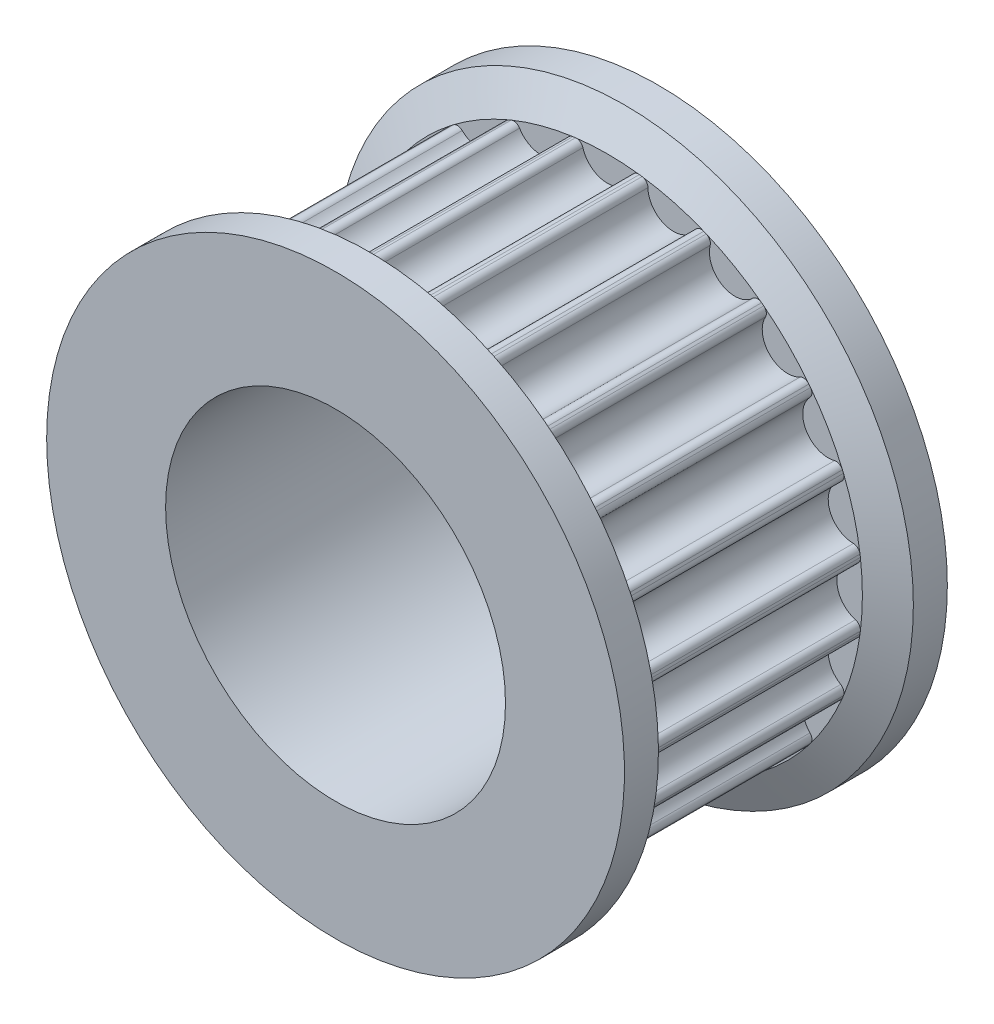
from build123d import *

# Parameters (mm, degrees)
SKETCH1_R           = 7.5
BOSS_EXTRUDE1_DEPTH = 7.5
SKETCH2_R           = 8.5
BOSS_EXTRUDE2_DEPTH = 1
BOSS_EXTRUDE3_START = -1
SKETCH3_R           = 8.5
BOSS_EXTRUDE3_DEPTH = 1
CUT_EXTRUDE3_START  = 0.5
SKETCH6_R           = 0.75
CUT_EXTRUDE3_DEPTH  = 6.5
SKETCH4_R           = 5
CUT_EXTRUDE1_DEPTH  = 8
SKETCH5_R           = 3.75
CUT_EXTRUDE2_DEPTH  = 39.426154601
FILLET2_R           = 0.2


with BuildPart() as part:
    # Sketch1 → Boss-Extrude1 (new body)
    with BuildSketch(Plane.XY.offset(-263.25)):
        with Locations((-3.046542689, 27.266558534)):
            Circle(SKETCH1_R)
    extrude(amount=-BOSS_EXTRUDE1_DEPTH)

    # Sketch2 → Boss-Extrude2 (add)
    with BuildSketch(Plane.XY.offset(-270.75)):
        with Locations((-3.046542689, 27.266558534)):
            Circle(SKETCH2_R)
    extrude(amount=-BOSS_EXTRUDE2_DEPTH)

    # Sketch3 → Boss-Extrude3 (add)
    with BuildSketch(Plane(origin=(0, 0, -263.25), x_dir=(-1, 0, 0), z_dir=(0, 0, -1)).offset(BOSS_EXTRUDE3_START)):
        with Locations(Location((3.046542689, 27.266558534, 0), (0, 0, 180))):
            Circle(SKETCH3_R)
    extrude(amount=BOSS_EXTRUDE3_DEPTH)

    # Sketch6 → Cut-Extrude3 (cut)
    with BuildSketch(Plane.XY.offset(-270.75).offset(CUT_EXTRUDE3_START)):
        with Locations((-3.046542689, 34.766558534)):
            Circle(SKETCH6_R)
        with Locations((-1.10539985, 34.511002232)):
            Circle(SKETCH6_R)
        with Locations((0.703457311, 33.761749063)):
            Circle(SKETCH6_R)
        with Locations((2.25675817, 32.569859393)):
            Circle(SKETCH6_R)
        with Locations((3.44864784, 31.016558534)):
            Circle(SKETCH6_R)
        with Locations((4.197901009, 29.207701373)):
            Circle(SKETCH6_R)
        with Locations((4.453457311, 27.266558534)):
            Circle(SKETCH6_R)
        with Locations((4.197901009, 25.325415696)):
            Circle(SKETCH6_R)
        with Locations((3.44864784, 23.516558534)):
            Circle(SKETCH6_R)
        with Locations((2.25675817, 21.963257675)):
            Circle(SKETCH6_R)
        with Locations((0.703457311, 20.771368006)):
            Circle(SKETCH6_R)
        with Locations((-1.10539985, 20.022114837)):
            Circle(SKETCH6_R)
        with Locations((-3.046542689, 19.766558534)):
            Circle(SKETCH6_R)
        with Locations((-4.987685527, 20.022114837)):
            Circle(SKETCH6_R)
        with Locations((-6.796542689, 20.771368006)):
            Circle(SKETCH6_R)
        with Locations((-8.349843548, 21.963257675)):
            Circle(SKETCH6_R)
        with Locations((-9.541733217, 23.516558534)):
            Circle(SKETCH6_R)
        with Locations((-10.290986386, 25.325415696)):
            Circle(SKETCH6_R)
        with Locations((-10.546542689, 27.266558534)):
            Circle(SKETCH6_R)
        with Locations((-10.290986386, 29.207701373)):
            Circle(SKETCH6_R)
        with Locations((-9.541733217, 31.016558534)):
            Circle(SKETCH6_R)
        with Locations((-8.349843548, 32.569859393)):
            Circle(SKETCH6_R)
        with Locations((-6.796542689, 33.761749063)):
            Circle(SKETCH6_R)
        with Locations((-4.987685527, 34.511002232)):
            Circle(SKETCH6_R)
    extrude(amount=CUT_EXTRUDE3_DEPTH, mode=Mode.SUBTRACT)

    # Sketch4 → Cut-Extrude1 (cut)
    with BuildSketch(Plane.XY.offset(-262.25)):
        with Locations((-3.046542689, 27.266558534)):
            Circle(SKETCH4_R)
    extrude(amount=-CUT_EXTRUDE1_DEPTH, mode=Mode.SUBTRACT)

    # Sketch5 → Cut-Extrude2 (cut, through all)
    with BuildSketch(Plane.XY.offset(-270.25)):
        with Locations((-3.046542689, 27.266558534)):
            Circle(SKETCH5_R)
    extrude(amount=-CUT_EXTRUDE2_DEPTH, mode=Mode.SUBTRACT)

    # Chamfer1: read off the stored shape, not the designer's step
    # Chamfer1 outline → Chamfer1 (revolve)
    with BuildSketch(Plane(origin=(-3.046542689, 27.266558534, 0), x_dir=(1, 0, 0), z_dir=(0, -1, 0))):
        Polygon((8.5, -270.75), (7.5, -270.25), (7.5, -270.75), align=None)
    revolve(axis=Axis((-3.046542689, 27.266558534, 0), (0, 0, 1)))

    # Chamfer2: read off the stored shape, not the designer's step
    # Chamfer2 outline → Chamfer2 (revolve)
    with BuildSketch(Plane(origin=(-3.046542689, 27.266558534, 0), x_dir=(1, 0, 0), z_dir=(0, -1, 0))):
        Polygon((7.5, -263.25), (7.5, -263.75), (8.5, -263.25), align=None)
    revolve(axis=Axis((-3.046542689, 27.266558534, 0), (0, 0, 1)))

    # Fillet2
    fillet2_edges = [part.edges().sort_by_distance(p)[0] for p in [
        (-3.795604602, 19.804058534, -267),
        (-2.297480775, 19.804058534, -267),
        (-5.70151806, 20.252208545, -267),
        (-4.254441565, 19.864465567, -267),
        (-7.426499335, 21.178374915, -267),
        (-6.129086043, 20.429313002, -267),
        (-8.852993802, 22.519440938, -267),
        (-7.793660285, 21.460107421, -267),
        (-9.883788221, 24.18401518, -267),
        (-9.134726308, 22.886601888, -267),
        (-10.448635656, 26.058659658, -267),
        (-10.060892678, 24.611583163, -267),
        (-2.297480775, 34.729058534, -267),
        (-10.509042689, 28.015620448, -267),
        (-10.509042689, 26.517496621, -267),
        (-3.795604602, 34.729058534, -267),
        (-10.060892678, 29.921533906, -267),
        (-10.448635656, 28.474457411, -267),
        (-9.134726308, 31.64651518, -267),
        (-9.883788221, 30.349101888, -267),
        (-7.793660285, 33.073009647, -267),
        (-8.852993802, 32.013676131, -267),
        (-6.129086043, 34.103804067, -267),
        (-7.426499335, 33.354742153, -267),
        (-4.254441565, 34.668651502, -267),
        (-5.70151806, 34.280908524, -267),
        (-0.391567317, 34.280908524, -267),
        (-1.838643812, 34.668651502, -267),
        (1.333413957, 33.354742153, -267),
        (0.036000665, 34.103804067, -267),
        (2.759908424, 32.013676131, -267),
        (1.700574908, 33.073009647, -267),
        (3.790702844, 30.349101888, -267),
        (3.04164093, 31.64651518, -267),
        (4.355550279, 28.474457411, -267),
        (3.967807301, 29.921533906, -267),
        (4.415957311, 26.517496621, -267),
        (4.415957311, 28.015620448, -267),
        (3.967807301, 24.611583163, -267),
        (4.355550279, 26.058659658, -267),
        (3.04164093, 22.886601888, -267),
        (3.790702844, 24.18401518, -267),
        (1.700574908, 21.460107421, -267),
        (2.759908424, 22.519440938, -267),
        (0.036000665, 20.429313002, -267),
        (1.333413957, 21.178374915, -267),
        (-1.838643812, 19.864465567, -267),
        (-0.391567317, 20.252208545, -267),
    ]]
    fillet(fillet2_edges, radius=FILLET2_R)


solid = part.part
